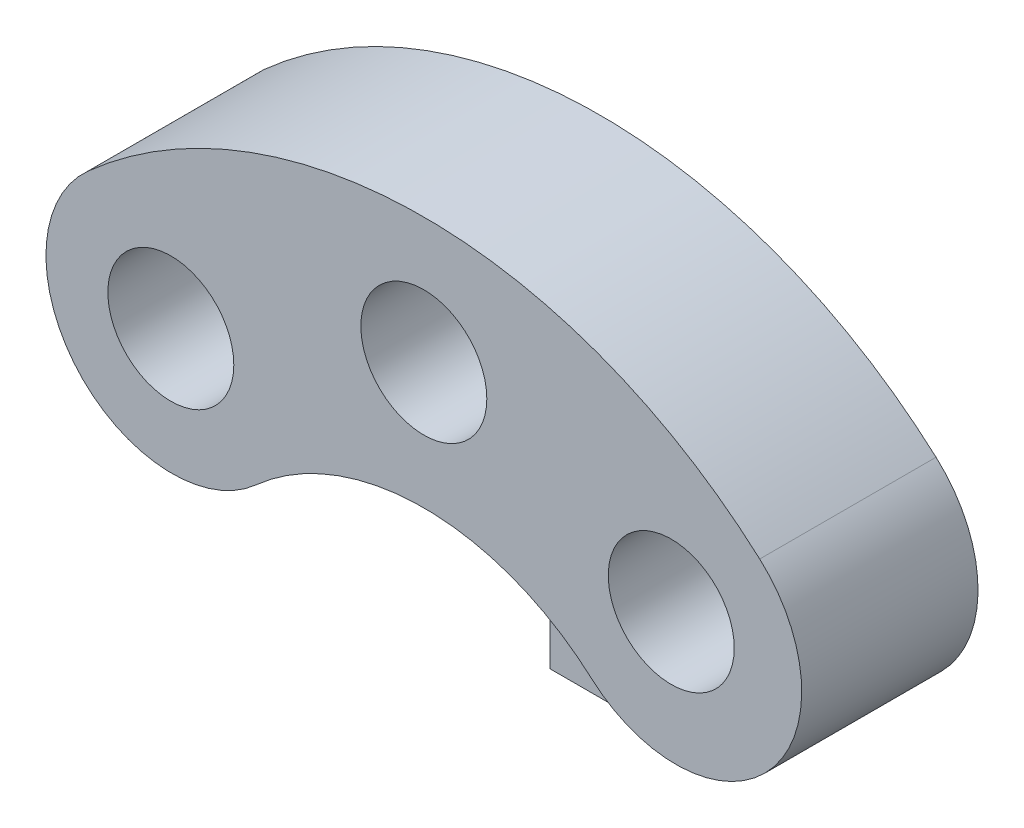
from build123d import *

# Parameters (mm, degrees)
BOSS_EXTRUDE1_DEPTH = 35
SKETCH4_R           = 12.5
CUT_EXTRUDE1_DEPTH  = 25
SKETCH12_W          = 20
SKETCH12_H          = 80
BOSS_EXTRUDE2_DEPTH = 10
SKETCH13_R          = 2
CUT_EXTRUDE2_DEPTH  = 133.853302556


with BuildPart() as part:
    # Sketch2 → Boss-Extrude1 (new body)
    with BuildSketch(Plane.XY):
        with BuildLine():
            ThreePointArc((66.666666667, 74.53559925), (0, 100), (-66.666666667, 74.53559925))
            ThreePointArc((-66.666666667, 74.53559925), (-68.633899812, 39.235032771), (-33.333333333, 37.267799625))
            ThreePointArc((-33.333333333, 37.267799625), (0, 50), (33.333333333, 37.267799625))
            ThreePointArc((33.333333333, 37.267799625), (68.633899812, 39.235032771), (66.666666667, 74.53559925))
        make_face()
    extrude(amount=BOSS_EXTRUDE1_DEPTH)

    # Sketch4 → Cut-Extrude1 (cut)
    with BuildSketch(Plane.XY.offset(35)):
        with Locations((-50.215956379, 55.707788728)):
            Circle(SKETCH4_R)
        with Locations((0, 75)):
            Circle(SKETCH4_R)
        with Locations((49.109932824, 56.685222925)):
            Circle(SKETCH4_R)
    extrude(amount=-CUT_EXTRUDE1_DEPTH, mode=Mode.SUBTRACT)

    # Sketch12 → Boss-Extrude2 (add)
    with BuildSketch(Plane(origin=(0, 0, 0), x_dir=(-1, 0, 0), z_dir=(0, 0, -1))):
        with Locations((0, 39.85040301)):
            Rectangle(SKETCH12_W, SKETCH12_H)
    extrude(amount=BOSS_EXTRUDE2_DEPTH)

    # Sketch13 → Cut-Extrude2 (cut, through all)
    with BuildSketch(Plane(origin=(0, 0, -10), x_dir=(-1, 0, 0), z_dir=(0, 0, -1))):
        with Locations((0, 11.479425563)):
            Circle(SKETCH13_R)
    extrude(amount=-CUT_EXTRUDE2_DEPTH, mode=Mode.SUBTRACT)


solid = part.part
